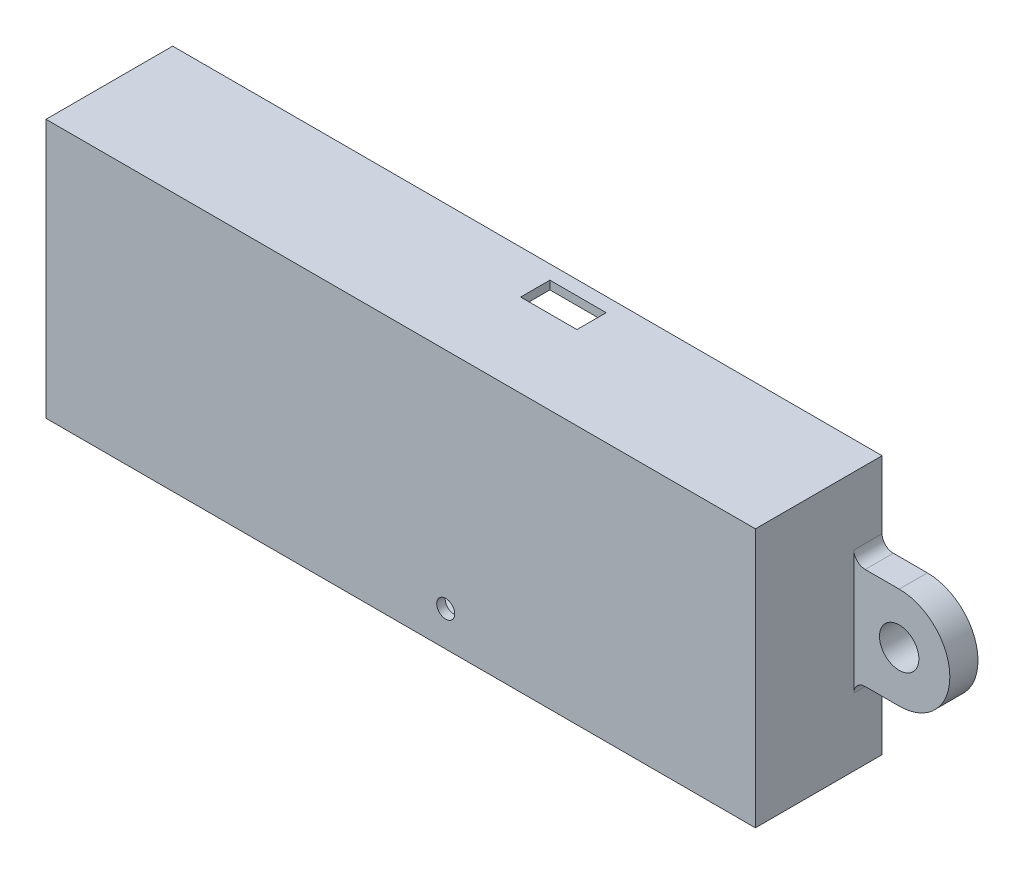
from build123d import *

# Parameters (mm, degrees)
SKETCH_1_W           = 123
SKETCH_1_H           = 43
EXTRUDE_1_DEPTH      = 1.5
EXTRUDE_2_DEPTH      = 21
EXTRUDE_2_DEPTH_BACK = 1.5
SKETCH_2_W           = 126
SKETCH_2_H           = 46
SKETCH_2_W_2         = 123
SKETCH_2_H_2         = 43
SKETCH_3_R           = 3.5
EXTRUDE_3_DEPTH      = 5
SKETCH_5_R           = 1.6
CUT_EXTRUDE_1_DEPTH  = 10
CUT_EXTRUDE_2_DEPTH  = 10
FILLET_1_R           = 2
SKETCH_8_W           = 14.5
SKETCH_8_H           = 9
CUT_EXTRUDE_4_DEPTH  = 10
SKETCH_10_W          = 10
SKETCH_10_H          = 5.2
CUT_EXTRUDE_5_DEPTH  = 10


with BuildPart() as part:
    # Эскиз1 → Бобышка-Вытянуть1 (new body)
    with BuildSketch(Plane.XY):
        with Locations((61.5, 21.5)):
            Rectangle(SKETCH_1_W, SKETCH_1_H)
    extrude(amount=EXTRUDE_1_DEPTH)

    # Эскиз2 → Бобышка-Вытянуть2 (add, two sides: drawn at the far end of the back side and taken through both)
    with BuildSketch(Plane(origin=(0, 0, 0), x_dir=(-1, 0, 0), z_dir=(0, 0, -1)).offset(-EXTRUDE_2_DEPTH_BACK)):
        with Locations((-61.5, 21.5)):
            Rectangle(SKETCH_2_W, SKETCH_2_H)
        with Locations((-61.5, 21.5)):
            Rectangle(SKETCH_2_W_2, SKETCH_2_H_2, mode=Mode.SUBTRACT)
    extrude(amount=EXTRUDE_2_DEPTH + EXTRUDE_2_DEPTH_BACK)

    # Эскиз3 → Бобышка-Вытянуть3 (add)
    with BuildSketch(Plane(origin=(0, 0, -21), x_dir=(-1, 0, 0), z_dir=(0, 0, -1))):
        with BuildLine():
            Line((-124.5, 12.5), (-132.54002612, 12.5))
            ThreePointArc((-132.54002612, 12.5), (-141.54002612, 21.5), (-132.54002612, 30.5))
            Line((-132.54002612, 30.5), (-124.5, 30.5))
            Line((-124.5, 30.5), (-124.5, 12.5))
        make_face()
        with Locations((-132.54002612, 21.5)):
            Circle(SKETCH_3_R, mode=Mode.SUBTRACT)
    extrude_3 = extrude(amount=-EXTRUDE_3_DEPTH)

    # Зеркальное отражение1: Бобышка-Вытянуть3 across plane
    add(extrude_3.mirror(Plane(origin=(61.5, 0, 0), x_dir=(0, 0, 1), z_dir=(1, 0, 0))))

    # Эскиз5 → Вырез-Вытянуть1 (cut)
    with BuildSketch(Plane.XY.offset(1.5)):
        with Locations((69.5, 4.7)):
            Circle(SKETCH_5_R)
    extrude(amount=-CUT_EXTRUDE_1_DEPTH, mode=Mode.SUBTRACT)

    # Эскиз6 → Вырез-Вытянуть2 (cut)
    with BuildSketch(Plane.ZY.offset(1.5)):
        Polygon((-11, 17.3), (-16, 17.3), (-16, 16.65), (-16, 9.65), (-16, 8.5), (-11, 8.5), align=None)
    extrude(amount=-CUT_EXTRUDE_2_DEPTH, mode=Mode.SUBTRACT)

    # Скругление1
    fillet_1_edges = [part.edges().sort_by_distance(p)[0] for p in [
        (124.5, 12.5, -18.5),
        (124.5, 30.5, -18.5),
        (-1.5, 30.5, -18.5),
        (-1.5, 12.5, -18.5),
    ]]
    fillet(fillet_1_edges, radius=FILLET_1_R)

    # Эскиз8 → Вырез-Вытянуть4 (cut)
    with BuildSketch(Plane.XZ.offset(1.5)):
        with Locations((55.75, -8)):
            Rectangle(SKETCH_8_W, SKETCH_8_H)
    extrude(amount=-CUT_EXTRUDE_4_DEPTH, mode=Mode.SUBTRACT)

    # Эскиз10 → Вырез-Вытянуть5 (cut)
    with BuildSketch(Plane(origin=(0, 44.5, 0), x_dir=(1, 0, 0), z_dir=(0, 1, 0))):
        with Locations((73, 15.9)):
            Rectangle(SKETCH_10_W, SKETCH_10_H)
    extrude(amount=-CUT_EXTRUDE_5_DEPTH, mode=Mode.SUBTRACT)


solid = part.part
